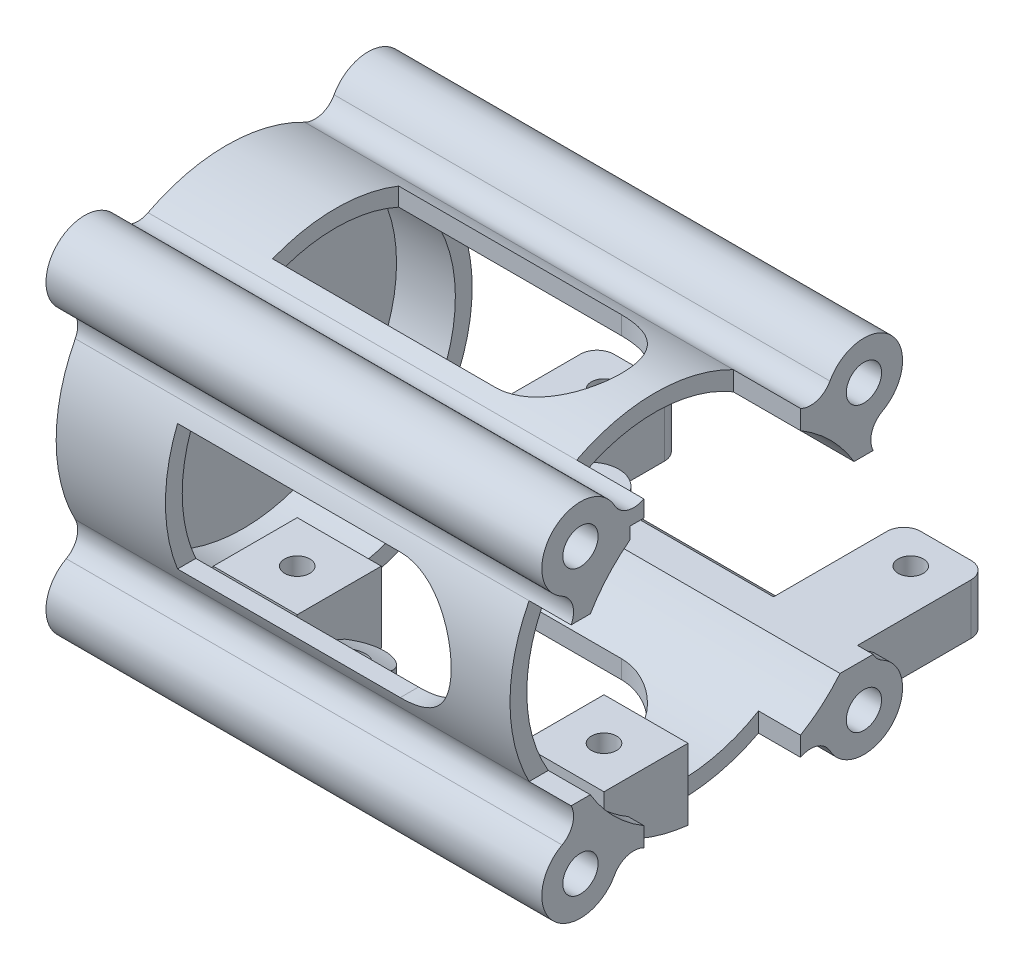
from build123d import *

# Parameters (mm, degrees)
SKETCH_1_R                   = 20.25
EXTRUDE_1_DEPTH              = 2
SKETCH_2_R                   = 3.5
CUT_EXTRUDE_1_DEPTH          = 29.70757739691735
SKETCH_3_R                   = 20.25
SKETCH_3_R_2                 = 10.25
EXTRUDE_2_DEPTH              = 4.1
SKETCH_5_R                   = 20.25
SKETCH_5_R_2                 = 16.25
EXTRUDE_3_DEPTH              = 5.4
SKETCH_6_R                   = 20.25
SKETCH_6_R_2                 = 18.25
EXTRUDE_4_DEPTH              = 47.5
SKETCH_7_R                   = 1.4999999999999996
CUT_EXTRUDE_2_DEPTH          = 66.58296272661063
PATTERN_CIRCULAR_1_COUNT     = 4
FILLET_1_R                   = 0.5
SKETCH_9_R                   = 4.600000000000003
SKETCH_9_R_2                 = 2.1000000000000147
EXTRUDE_6_DEPTH              = 59
EXTRUDE_7_DEPTH              = 59
PATTERN_CIRCULAR_3_COUNT     = 4
CUT_EXTRUDE_3_DEPTH          = 67.3509550787019
PATTERN_CIRCULAR_4_COUNT     = 2
PATTERN_CIRCULAR_4_ANGLE     = 270.0000000000018
SKETCH_22_R                  = 18.25
CUT_EXTRUDE_9_DEPTH          = 20
SKETCH_23_W                  = 5
SKETCH_23_H                  = 18.640041254439932
CUT_EXTRUDE_10_DEPTH         = 77.05670983838165
PATTERN_CIRCULAR_5_COUNT     = 2
PATTERN_CIRCULAR_5_ANGLE     = 270.0000000000006
EXTRUDE_10_REACH             = 78.057
EXTRUDE_10_END_RADIUS        = 18.25
SKETCH_26_R                  = 3.5
SKETCH_26_R_2                = 1.3499999999999983
SKETCH_27_R                  = 3.4999999999999996
SKETCH_27_R_2                = 1.3500000000000054
EXTRUDE_11_DEPTH             = 8.645788
SKETCH_28_R                  = 1.349999999999999
SKETCH_28_R_2                = 1.3500000000000054
CUT_EXTRUDE_12_DEPTH         = 8.645788278
SKETCH_32_W                  = 5.000000000000002
SKETCH_32_H                  = 5
CUT_EXTRUDE_14_DEPTH         = 50
SKETCH_33_W                  = 9.999999999999986
SKETCH_33_H                  = 6.034517358518986
SKETCH_33_W_2                = 10.000000000000002
EXTRUDE_12_DEPTH             = 12
EXTRUDE_12_DIRECTION_2_REACH = 78.057
SKETCH_34_R                  = 1.5000000000000042
SKETCH_34_R_2                = 1.5000000000000009
CUT_EXTRUDE_15_DEPTH         = 8.394476
EXTRUDE_14_REACH             = 77.495
EXTRUDE_14_END_RADIUS        = 20.25
SKETCH_35_R                  = 1.5000000000000007
SKETCH_35_W                  = 9.999999999999986
SKETCH_35_H                  = 10.000000000000002
SKETCH_35_R_2                = 1.500000000000004
SKETCH_36_R                  = 1.5000000000000042
SKETCH_36_R_2                = 1.5000000000000044
CUT_EXTRUDE_16_DEPTH         = 76.49456172131225
SKETCH_30_R                  = 2.100000000000015
CUT_EXTRUDE_18_DEPTH         = 72.14490268107751
CUT_EXTRUDE_19_DEPTH         = 6.5
CUT_EXTRUDE_START            = -3
CUT_EXTRUDE_20_DEPTH         = 3
FILLET_2_R                   = 2


with BuildPart() as part:
    # Эскиз1 → Бобышка-Вытянуть1 (new body)
    with BuildSketch(Plane(origin=(0, 0, 0), x_dir=(0, 0, -1), z_dir=(1, 0, 0))):
        Circle(SKETCH_1_R)
    extrude(amount=EXTRUDE_1_DEPTH)

    # Эскиз2 → Вырез-Вытянуть1 (cut, through all)
    with BuildSketch(Plane.ZY):
        Circle(SKETCH_2_R)
    extrude(amount=-CUT_EXTRUDE_1_DEPTH, mode=Mode.SUBTRACT)

    # Эскиз3 → Бобышка-Вытянуть2 (add)
    with BuildSketch(Plane(origin=(2, 0, 0), x_dir=(0, 0, -1), z_dir=(1, 0, 0))):
        Circle(SKETCH_3_R)
        Circle(SKETCH_3_R_2, mode=Mode.SUBTRACT)
    extrude(amount=EXTRUDE_2_DEPTH)

    # Эскиз5 → Бобышка-Вытянуть3 (add)
    with BuildSketch(Plane(origin=(6.1, 0, 0), x_dir=(0, 0, -1), z_dir=(1, 0, 0))):
        Circle(SKETCH_5_R)
        with Locations(Location((0, 0, 0), (0, 0, 180))):
            Circle(SKETCH_5_R_2, mode=Mode.SUBTRACT)
    extrude(amount=EXTRUDE_3_DEPTH)

    # Эскиз6 → Бобышка-Вытянуть4 (add)
    with BuildSketch(Plane(origin=(11.5, 0, 0), x_dir=(0, 0, -1), z_dir=(1, 0, 0))):
        Circle(SKETCH_6_R)
        Circle(SKETCH_6_R_2, mode=Mode.SUBTRACT)
    extrude(amount=EXTRUDE_4_DEPTH)

    # Эскиз7 → Вырез-Вытянуть2 (cut, through all)
    with BuildSketch(Plane.ZY):
        with Locations((-9.192388155425117, 9.192388155425114)):
            Circle(SKETCH_7_R)
    cut_extrude_2 = extrude(amount=-CUT_EXTRUDE_2_DEPTH, mode=Mode.SUBTRACT)

    # Круговой массив1: Вырез-Вытянуть2 ×4 about axis
    pattern_circular_1_axis = Axis((0, -1.605e-14, -1.605e-14), (1, 0, 0))
    for i in range(1, PATTERN_CIRCULAR_1_COUNT):
        add(cut_extrude_2.rotate(pattern_circular_1_axis, i * 360 / PATTERN_CIRCULAR_1_COUNT), mode=Mode.SUBTRACT)

    # Скругление1
    fillet_1_edges = [part.edges().sort_by_distance(p)[0] for p in [
        (2, 5.81e-15, 10.25),
        (6.1, 5.81e-15, 10.25),
        (6.1, -3.98e-15, -16.25),
        (11.5, -3.98e-15, -16.25),
        (11.5, 2.23e-15, 18.25),
    ]]
    fillet(fillet_1_edges, radius=FILLET_1_R)

    # Эскиз9 → Бобышка-Вытянуть6 (add)
    with BuildSketch(Plane.ZY):
        with Locations((-16.864496731299074, 16.864496731299248)):
            Circle(SKETCH_9_R)
        with Locations((-16.864496731299074, 16.864496731299248)):
            Circle(SKETCH_9_R_2, mode=Mode.SUBTRACT)
    extrude_6 = extrude(amount=-EXTRUDE_6_DEPTH)

    # Эскиз10 → Бобышка-Вытянуть7 (add)
    with BuildSketch(Plane.ZY):
        with BuildLine():
            ThreePointArc((-9.3200206272199, 17.977756131069178), (-11.2893731307851, 17.800047957085134), (-12.81870845378297, 19.053468456450876))
            ThreePointArc((-12.818708453782968, 19.05346845645088), (-12.323239372103286, 17.597287013406042), (-12.335539952102426, 16.059170404790063))
            ThreePointArc((-12.335539952102433, 16.059170404790052), (-10.870191755366843, 17.085123095885336), (-9.320020627219897, 17.977756131069178))
        make_face()
        with BuildLine():
            ThreePointArc((-16.059170404789935, 12.335539952102595), (-17.597287013405943, 12.323239372103476), (-19.053468456450794, 12.818708453783195))
            ThreePointArc((-19.053468456450794, 12.818708453783193), (-17.800047957085088, 11.289373130785297), (-17.977756131069086, 9.320020627220094))
            ThreePointArc((-17.977756131069086, 9.320020627220092), (-17.085123095885223, 10.870191755367024), (-16.059170404789924, 12.335539952102597))
        make_face()
    extrude_7 = extrude(amount=-EXTRUDE_7_DEPTH)

    # Круговой массив3: Бобышка-Вытянуть6, Бобышка-Вытянуть7 ×4 about axis
    pattern_circular_3_axis = Axis((0, -2.819e-14, -2.819e-14), (1, 0, 0))
    add([extrude_6.rotate(pattern_circular_3_axis, i * 360 / PATTERN_CIRCULAR_3_COUNT) for i in range(1, PATTERN_CIRCULAR_3_COUNT)])
    add([extrude_7.rotate(pattern_circular_3_axis, i * 360 / PATTERN_CIRCULAR_3_COUNT) for i in range(1, PATTERN_CIRCULAR_3_COUNT)])

    # Эскиз11 → Вырез-Вытянуть3 (cut, symmetric)
    with BuildSketch(Plane(origin=(0, 0, 0), x_dir=(1, 0, 0), z_dir=(0, 1, 0))):
        with BuildLine():
            Line((12.999999999999996, 7.5), (39.50000000000001, 7.500000000000007))
            ThreePointArc((39.50000000000001, 7.500000000000007), (47.000000000000014, 4.34e-15), (39.50000000000001, -7.5))
            Line((39.50000000000001, -7.5), (12.999999999999998, -7.5))
            Line((12.999999999999998, -7.5), (12.999999999999996, 7.5))
        make_face()
    cut_extrude_3 = extrude(amount=CUT_EXTRUDE_3_DEPTH, both=True, mode=Mode.SUBTRACT)

    # Круговой массив4: Вырез-Вытянуть3 ×2 about axis
    pattern_circular_4_axis = Axis((2, 0, 0), (-1, 0, 0))
    for i in range(1, PATTERN_CIRCULAR_4_COUNT):
        add(cut_extrude_3.rotate(pattern_circular_4_axis, i * PATTERN_CIRCULAR_4_ANGLE / (PATTERN_CIRCULAR_4_COUNT - 1)), mode=Mode.SUBTRACT)

    # Эскиз22 → Вырез-Вытянуть9 (cut)
    with BuildSketch(Plane(origin=(2, 0, 0), x_dir=(0, 0, -1), z_dir=(1, 0, 0))):
        Circle(SKETCH_22_R)
    extrude(amount=CUT_EXTRUDE_9_DEPTH, mode=Mode.SUBTRACT)

    # Эскиз23 → Вырез-Вытянуть10 (cut, through all)
    with BuildSketch(Plane(origin=(0, -21.464496731299196, -7.286e-14), x_dir=(-1, 0, 0), z_dir=(0, -1, -3.39e-15))):
        with Locations((-56.50000000000001, 1.78e-15)):
            Rectangle(SKETCH_23_W, SKETCH_23_H)
    cut_extrude_10 = extrude(amount=-CUT_EXTRUDE_10_DEPTH, mode=Mode.SUBTRACT)

    # Круговой массив5: Вырез-Вытянуть10 ×2 about axis
    pattern_circular_5_axis = Axis((2, 0, 0), (-1, 0, 0))
    for i in range(1, PATTERN_CIRCULAR_5_COUNT):
        add(cut_extrude_10.rotate(pattern_circular_5_axis, i * PATTERN_CIRCULAR_5_ANGLE / (PATTERN_CIRCULAR_5_COUNT - 1)), mode=Mode.SUBTRACT)

    # Бобышка-Вытянуть10: up to this cylinder (the profile starts outside it)
    extrude_10_end = Plane(origin=(23.65, 0, 0), z_dir=(-1, 0, 0)) * Cylinder(EXTRUDE_10_END_RADIUS, 193.614, mode=Mode.PRIVATE)
    # Эскиз26 → Бобышка-Вытянуть10 (add, up to the surface)
    with BuildSketch(Plane(origin=(0, -21.464496731299196, -7.286e-14), x_dir=(-1, 0, 0), z_dir=(0, -1, -3.39e-15)), mode=Mode.PRIVATE) as extrude_10_sk1:
        with Locations(Location((-23.650000000000006, -8.354496731299136, 0), (0, 0, 90))):
            Circle(SKETCH_26_R)
        with Locations(Location((-23.650000000000006, -8.354496731299136, 0), (0, 0, 90))):
            Circle(SKETCH_26_R_2, mode=Mode.SUBTRACT)
    extrude_10_tool1 = extrude(extrude_10_sk1.sketch, amount=-EXTRUDE_10_REACH, mode=Mode.PRIVATE) - extrude_10_end
    add(extrude_10_tool1.solids().sort_by_distance((23.65, -21.464497, 11.755502))[0])

    # Эскиз28 → Вырез-Вытянуть12 (cut)
    with BuildSketch(Plane.XZ.offset(21.464496731299196)):
        with Locations(Location((23.650000000000006, 8.354496731299136, 0), (0, 0, 270))):
            Circle(SKETCH_28_R)
        with Locations(Location((23.65, -19.544496731299134, 0), (0, 0, 270))):
            Circle(SKETCH_28_R_2)
    extrude(amount=-CUT_EXTRUDE_12_DEPTH, mode=Mode.SUBTRACT)

    # Эскиз32 → Вырез-Вытянуть14 (cut)
    with BuildSketch(Plane(origin=(59, 0, 0), x_dir=(0, 0, -1), z_dir=(1, 0, 0))):
        Polygon((24.999999999999996, 9.320020627219854), (9.999999999999998, 9.32002062721985), (10, -11.67997937278015), (25, -11.679979372780148), align=None)
        with Locations((-8.5, 13.5)):
            Rectangle(SKETCH_32_W, SKETCH_32_H)
    extrude(amount=-CUT_EXTRUDE_14_DEPTH, mode=Mode.SUBTRACT)

    # Эскиз33 → Бобышка-Вытянуть12 (add)
    with BuildSketch(Plane(origin=(0, 7.286e-14, -21.464496731299135), x_dir=(-1, 0, 0), z_dir=(0, 3.39e-15, -1))):
        with Locations((-52.15, -14.6972380520397)):
            Rectangle(SKETCH_33_W, SKETCH_33_H)
        with Locations((-15.649999999999999, -14.6972380520397)):
            Rectangle(SKETCH_33_W_2, SKETCH_33_H)
    extrude(amount=EXTRUDE_12_DEPTH)

    # Эскиз33 → Бобышка-Вытянуть12 direction 2 (add, up to next)
    with BuildSketch(Plane(origin=(0, 7.286e-14, -21.464496731299135), x_dir=(-1, 0, 0), z_dir=(0, 3.39e-15, -1)), mode=Mode.PRIVATE) as extrude_12_direction_2_sk1:
        with Locations((-52.15, -14.6972380520397)):
            Rectangle(SKETCH_33_W, SKETCH_33_H)
    extrude_12_direction_2_tool1 = extrude(extrude_12_direction_2_sk1.sketch, amount=-EXTRUDE_12_DIRECTION_2_REACH, mode=Mode.PRIVATE) - part.part
    # Эскиз33 → Бобышка-Вытянуть12 direction 2 (add, up to next)
    with BuildSketch(Plane(origin=(0, 7.286e-14, -21.464496731299135), x_dir=(-1, 0, 0), z_dir=(0, 3.39e-15, -1)), mode=Mode.PRIVATE) as extrude_12_direction_2_sk2:
        with Locations((-15.649999999999999, -14.6972380520397)):
            Rectangle(SKETCH_33_W_2, SKETCH_33_H)
    extrude_12_direction_2_tool2 = extrude(extrude_12_direction_2_sk2.sketch, amount=-EXTRUDE_12_DIRECTION_2_REACH, mode=Mode.PRIVATE) - part.part
    add(extrude_12_direction_2_tool1.solids().sort_by_distance((52.15, -14.697238, -21.464497))[0])
    add(extrude_12_direction_2_tool1.solids().sort_by_distance((52.15, -14.697238, -21.464497))[1])
    add(extrude_12_direction_2_tool2.solids().sort_by_distance((15.65, -14.697238, -21.464497))[0])
    add(extrude_12_direction_2_tool2.solids().sort_by_distance((15.65, -14.697238, -21.464497))[1])

    # Эскиз34 → Вырез-Вытянуть15 (cut)
    with BuildSketch(Plane.XZ.offset(17.714496731299192)):
        with Locations(Location((52.15, -29.28449673129913, 0), (0, 0, 270))):
            Circle(SKETCH_34_R)
        with Locations(Location((15.649999999999997, -29.28449673129913, 0), (0, 0, 270))):
            Circle(SKETCH_34_R_2)
    extrude(amount=-CUT_EXTRUDE_15_DEPTH, mode=Mode.SUBTRACT)

    # Бобышка-Вытянуть14: up to this cylinder (the profile starts inside it)
    extrude_14_end = Plane(origin=(33.9, 0, 0), z_dir=(-1, 0, 0)) * Cylinder(EXTRUDE_14_END_RADIUS, 232.99, mode=Mode.PRIVATE)
    # Эскиз35 → Бобышка-Вытянуть14 (add, up to the surface)
    with BuildSketch(Plane(origin=(0, -11.679979372780151, -1.35e-15), x_dir=(1, 0, 0), z_dir=(0, 1, 1.2e-16)), mode=Mode.PRIVATE) as extrude_14_sk1:
        Polygon((10.649999999999997, -2.2155032687008376), (20.65, -2.2155032687008376), (20.650000000000002, -12.215503268700838), (10.649999999999999, -12.215503268700838), align=None)
        with Locations(Location((15.649999999999997, -7.215503268700838, 0), (0, 0, 270))):
            Circle(SKETCH_35_R, mode=Mode.SUBTRACT)
    extrude_14_tool1 = extrude(extrude_14_sk1.sketch, amount=-EXTRUDE_14_REACH, mode=Mode.PRIVATE) & extrude_14_end
    add(extrude_14_tool1.solids().sort_by_distance((15.65, -11.679979, 2.356925))[0])
    # Эскиз35 → Бобышка-Вытянуть14 (add, up to the surface)
    with BuildSketch(Plane(origin=(0, -11.679979372780151, -1.35e-15), x_dir=(1, 0, 0), z_dir=(0, 1, 1.2e-16)), mode=Mode.PRIVATE) as extrude_14_sk2:
        with Locations((52.15, -7.215503268700837)):
            Rectangle(SKETCH_35_W, SKETCH_35_H)
        with Locations(Location((52.15, -7.215503268700837, 0), (0, 0, 270))):
            Circle(SKETCH_35_R_2, mode=Mode.SUBTRACT)
    extrude_14_tool2 = extrude(extrude_14_sk2.sketch, amount=-EXTRUDE_14_REACH, mode=Mode.PRIVATE) & extrude_14_end
    add(extrude_14_tool2.solids().sort_by_distance((52.15, -11.679979, 2.356925))[0])

    # Эскиз36 → Вырез-Вытянуть16 (cut, through all)
    with BuildSketch(Plane(origin=(0, -11.679979372780151, -2.03e-15), x_dir=(1, 0, 0), z_dir=(0, 1, 1.7e-16))):
        with Locations(Location((15.649999999999997, -7.215503268700838, 0), (0, 0, 270))):
            Circle(SKETCH_36_R)
        with Locations(Location((52.15, -7.215503268700837, 0), (0, 0, 270))):
            Circle(SKETCH_36_R_2)
    extrude(amount=-CUT_EXTRUDE_16_DEPTH, mode=Mode.SUBTRACT)

    # Эскиз38 → Вырез-Вытянуть19 (cut)
    with BuildSketch(Plane(origin=(0, -21.464496731299196, -7.286e-14), x_dir=(-1, 0, 0), z_dir=(0, -1, -3.39e-15))):
        Polygon((-49.1, 29.28449673129914), (-50.62499999999999, 31.92587421284165), (-53.67499999999999, 31.92587421284165), (-55.19999999999998, 29.284496731299125), (-53.67499999999998, 26.643119249756598), (-50.625, 26.643119249756598), align=None)
        Polygon((-12.599999999999996, 29.284496731299136), (-14.124999999999991, 31.92587421284166), (-17.17499999999999, 31.92587421284166), (-18.69999999999999, 29.28449673129912), (-17.174999999999994, 26.643119249756595), (-14.125, 26.643119249756595), align=None)
        Polygon((-49.1, -7.215503268700907), (-50.625, -4.574125787158378), (-53.67499999999999, -4.574125787158378), (-55.19999999999999, -7.215503268700909), (-53.67499999999999, -9.856880750243443), (-50.625, -9.856880750243443), align=None)
        Polygon((-12.599999999999996, -7.215503268700903), (-14.12499999999999, -4.574125787158378), (-17.174999999999994, -4.574125787158378), (-18.69999999999999, -7.215503268700911), (-17.174999999999994, -9.85688075024344), (-14.124999999999995, -9.85688075024344), align=None)
    extrude(amount=-CUT_EXTRUDE_19_DEPTH, mode=Mode.SUBTRACT)

    # Эскиз39 → Вырез-Вытянуть20 (cut)
    with BuildSketch(Plane(origin=(54, 0, 0), x_dir=(0, 0, -1), z_dir=(1, 0, 0)).offset(CUT_EXTRUDE_START)):
        with BuildLine():
            Line((9.320020627219908, 17.977756131069174), (9.320020627219915, 15.690752547541983))
            ThreePointArc((9.320020627219915, 15.690752547541983), (0.311789822503662, 18.247336438685593), (-8.778524933039717, 16))
            Line((-8.778524933039717, 16), (-9.320020627220018, 16))
            Line((-9.320020627220018, 16), (-9.320020627220025, 17.97775613106917))
            ThreePointArc((-9.320020627220025, 17.97775613106917), (-5.272e-14, 20.249999999999996), (9.320020627219908, 17.977756131069174))
        make_face()
    extrude(amount=CUT_EXTRUDE_20_DEPTH, mode=Mode.SUBTRACT)

    # Скругление2
    fillet_2_edges = [part.edges().sort_by_distance(p)[0] for p in [
        (57.15, -14.697238052039587, -33.464496731299185),
        (47.15, -14.697238052039586, -33.464496731299185),
        (20.65, -14.697238052039587, -33.464496731299185),
        (10.649999999999997, -14.697238052039587, -33.464496731299185),
    ]]
    fillet(fillet_2_edges, radius=FILLET_2_R)


with BuildPart() as body_2:
    # Эскиз27 → Бобышка-Вытянуть11 (new body)
    with BuildSketch(Plane(origin=(0, -21.464496731299196, -7.286e-14), x_dir=(-1, 0, 0), z_dir=(0, -1, -3.39e-15))):
        with Locations(Location((-23.65, 19.544496731299134, 0), (0, 0, 90))):
            Circle(SKETCH_27_R)
        with Locations(Location((-23.65, 19.544496731299134, 0), (0, 0, 90))):
            Circle(SKETCH_27_R_2, mode=Mode.SUBTRACT)
    extrude(amount=-EXTRUDE_11_DEPTH)

    # Эскиз30 → Вырез-Вытянуть18 (cut, through all)
    with BuildSketch(Plane(origin=(59, 0, 0), x_dir=(0, 0, -1), z_dir=(1, 0, 0))):
        with Locations(Location((16.86449673129919, -16.864496731299134, 0), (0, 0, 90))):
            Circle(SKETCH_30_R)
    extrude(amount=-CUT_EXTRUDE_18_DEPTH, mode=Mode.SUBTRACT)


solid = Compound([part.part, body_2.part])
